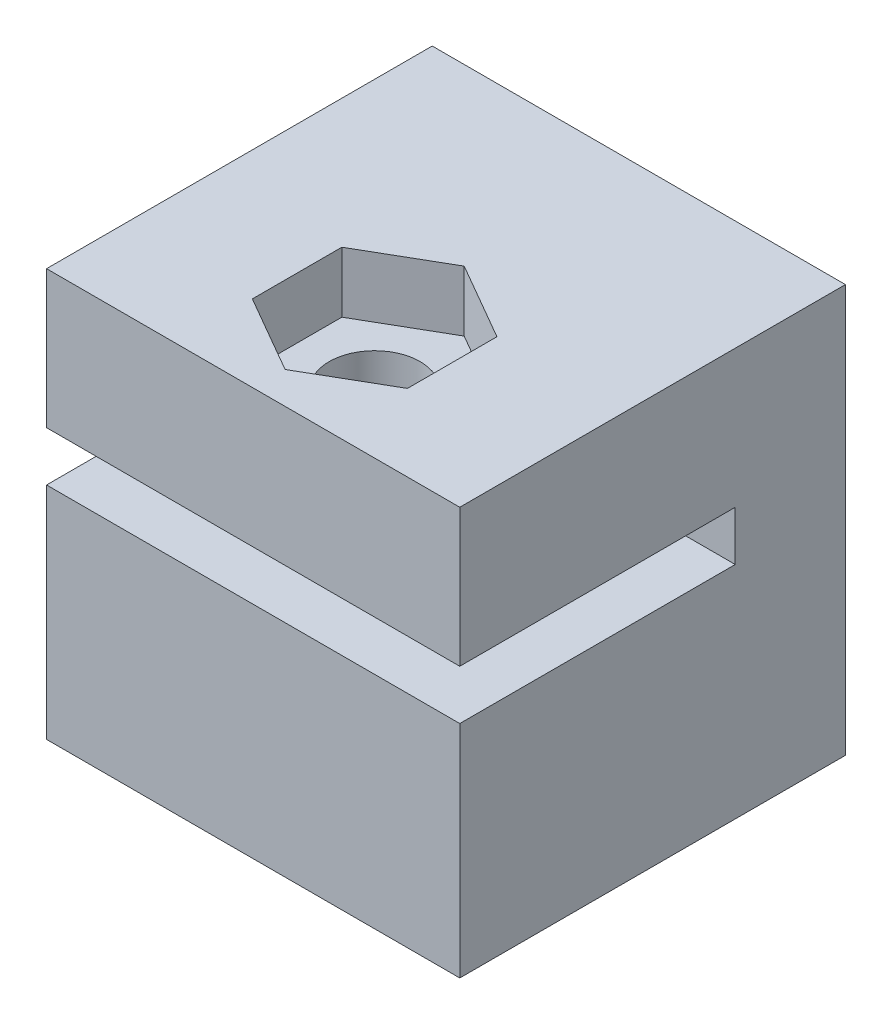
from build123d import *

# Parameters (mm, degrees)
SKETCH1_W    = 15
SKETCH1_H    = 14
BASE_DEPTH   = 8
SKETCH3_W    = 15
SKETCH3_H    = 4
SPACER_DEPTH = 1.8
SKETCH4_W    = 15
SKETCH4_H    = 14
TOP_DEPTH    = 5
BORE_DEPTH   = 19.008053754
NUT_DEPTH    = 2.2


with BuildPart() as part:
    # Sketch1 → base (new body)
    with BuildSketch(Plane(origin=(0, 0, 0), x_dir=(1, 0, 0), z_dir=(0, 1, 0))):
        Rectangle(SKETCH1_W, SKETCH1_H)
    extrude(amount=BASE_DEPTH)

    # Sketch3 → spacer (add)
    with BuildSketch(Plane(origin=(0, 8, 0), x_dir=(1, 0, 0), z_dir=(0, 1, 0))):
        with Locations((0, 5)):
            Rectangle(SKETCH3_W, SKETCH3_H)
    extrude(amount=SPACER_DEPTH)

    # Sketch4 → top (add)
    with BuildSketch(Plane(origin=(0, 9.8, 0), x_dir=(1, 0, 0), z_dir=(0, 1, 0))):
        Rectangle(SKETCH4_W, SKETCH4_H)
    extrude(amount=TOP_DEPTH)

    # Sketch5 → bore (cut, through all)
    with BuildSketch(Plane(origin=(0, 14.8, 0), x_dir=(1, 0, 0), z_dir=(0, 1, 0))):
        with BuildLine():
            ThreePointArc((1.65, -2.59), (1.166726189, -1.423273811), (0, -0.94))
            ThreePointArc((0, -0.94), (-1.166726189, -3.756726189), (1.65, -2.59))
        make_face()
    extrude(amount=-BORE_DEPTH, mode=Mode.SUBTRACT)

    # Sketch6 → nut (cut)
    with BuildSketch(Plane(origin=(0, 14.8, 0), x_dir=(1, 0, 0), z_dir=(0, 1, 0))):
        Polygon((0, 0.66), (-2.814582562, -0.965), (-2.814582562, -4.215), (0, -5.84), (2.814582562, -4.215), (2.814582562, -0.965), align=None)
    extrude(amount=-NUT_DEPTH, mode=Mode.SUBTRACT)


solid = part.part
